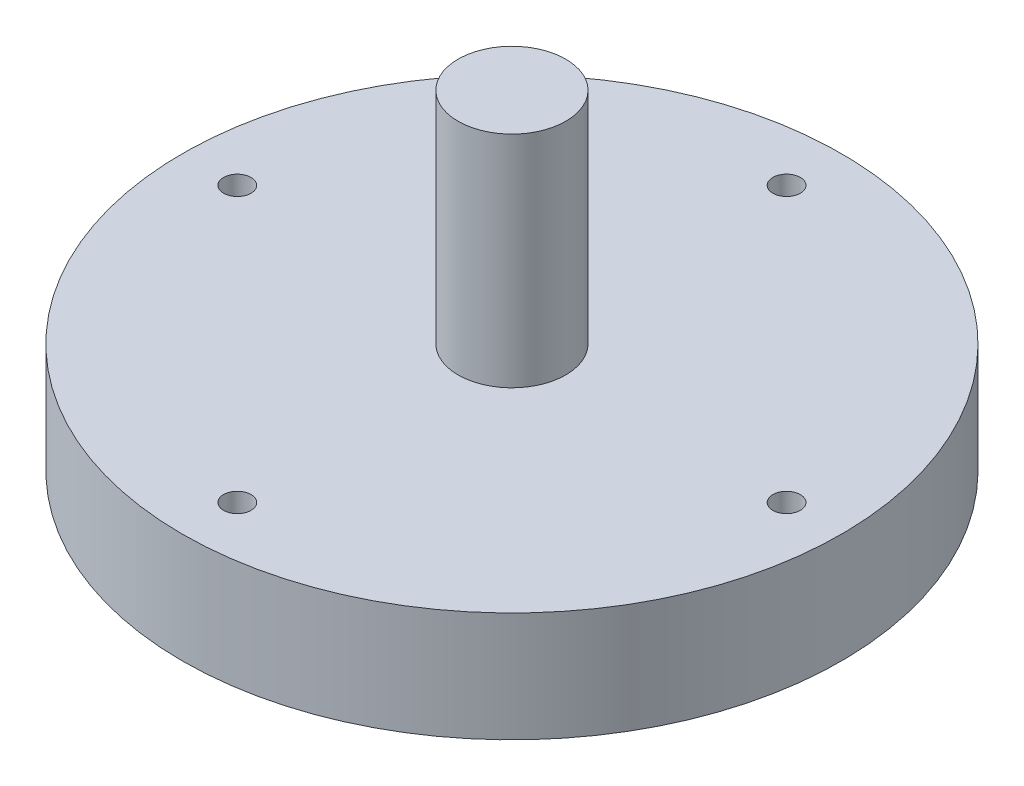
from build123d import *

# Parameters (mm, degrees)
SKETCH1_R           = 38.1
BOSS_EXTRUDE1_DEPTH = 12.7
SKETCH2_R           = 6.223
BOSS_EXTRUDE2_DEPTH = 25.4
SKETCH3_R           = 1.5875
CUT_EXTRUDE1_DEPTH  = 60.56828015
CIRPATTERN1_COUNT   = 4


with BuildPart() as part:
    # Sketch1 → Boss-Extrude1 (new body)
    with BuildSketch(Plane(origin=(0, 0, 0), x_dir=(1, 0, 0), z_dir=(0, 1, 0))):
        Circle(SKETCH1_R)
    extrude(amount=BOSS_EXTRUDE1_DEPTH)

    # Sketch2 → Boss-Extrude2 (add)
    with BuildSketch(Plane(origin=(0, 12.7, 0), x_dir=(1, 0, 0), z_dir=(0, 1, 0))):
        Circle(SKETCH2_R)
    extrude(amount=BOSS_EXTRUDE2_DEPTH)

    # Sketch3 → Cut-Extrude1 (cut, through all)
    with BuildSketch(Plane(origin=(0, 12.7, 0), x_dir=(1, 0, 0), z_dir=(0, 1, 0))):
        with Locations((0, 31.75)):
            Circle(SKETCH3_R)
    cut_extrude1 = extrude(amount=-CUT_EXTRUDE1_DEPTH, mode=Mode.SUBTRACT)

    # CirPattern1: Cut-Extrude1 ×4 about axis
    cirpattern1_axis = Axis((0, 12.7, 0), (0, 1, 0))
    for i in range(1, CIRPATTERN1_COUNT):
        add(cut_extrude1.rotate(cirpattern1_axis, i * 360 / CIRPATTERN1_COUNT), mode=Mode.SUBTRACT)


solid = part.part
